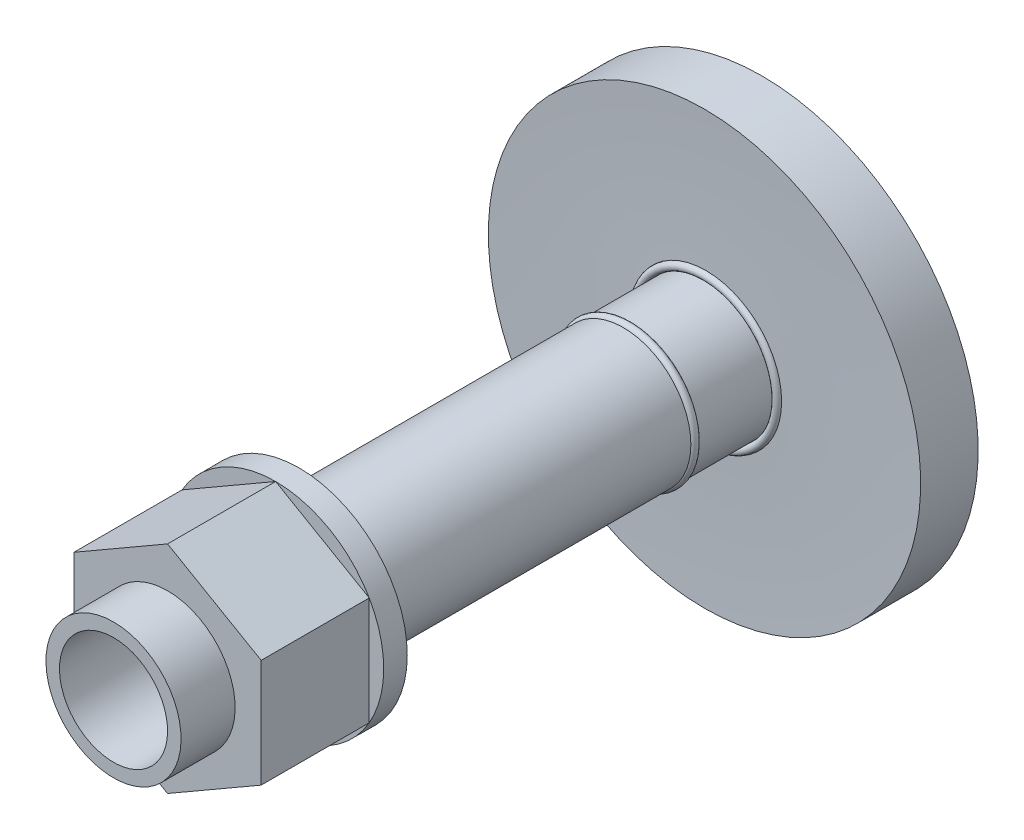
from build123d import *

# Parameters (mm, degrees)
SKETCH2_R          = 47.475732925
CUT_EXTRUDE1_DEPTH = 40
SKETCH3_W          = 3
SKETCH3_H          = 2
SKETCH3_W_2        = 2
SKETCH3_H_2        = 3
SKETCH4_W          = 2
SKETCH4_H          = 3
SKETCH5_R          = 1.5
SKETCH5_R_2        = 1.464909104
SKETCH5_R_3        = 1.4
SKETCH5_R_4        = 1.438808622


with BuildPart() as part:
    # Sketch1 → Revolve1 (revolve)
    with BuildSketch(Plane(origin=(0, 0, 0), x_dir=(0, 0, -1), z_dir=(1, 0, 0))):
        with BuildLine():
            Line((-146.741602405, 20), (93.258397595, 20))
            Line((93.258397595, 20), (93.258397595, 80))
            Line((93.258397595, 80), (71.96969697, 80))
            ThreePointArc((71.96969697, 80), (72.591794071, 52.503354195), (72.457468383, 25))
            Line((72.457468383, 25), (-76.741602405, 25))
            ThreePointArc((-76.741602405, 25), (-77.353874169, 32.502755976), (-78.03030303, 40))
            Line((-78.03030303, 40), (-126.741602405, 40))
            Line((-126.741602405, 40), (-126.741602405, 25))
            Line((-126.741602405, 25), (-146.741602405, 25))
            Line((-146.741602405, 25), (-146.741602405, 20))
        make_face()
    revolve(axis=Axis((0, 0, -93.258397595), (0, 0, 1)))

    # Sketch2 → Cut-Extrude1 (cut)
    with BuildSketch(Plane.XY.offset(126.741602405)):
        Circle(SKETCH2_R)
        Polygon((34.641016151, -20), (34.641016151, 20), (0, 40), (-34.641016151, 20), (-34.641016151, -20), (0, -40), align=None, mode=Mode.SUBTRACT)
    extrude(amount=-CUT_EXTRUDE1_DEPTH, mode=Mode.SUBTRACT)

    # Sketch3 → Cut-Revolve1 (revolve, cut)
    with BuildSketch(Plane(origin=(0, 0, 0), x_dir=(1, 0, 0), z_dir=(0, 1, 0))):
        with Locations((26.5, 72.96969697)):
            Rectangle(SKETCH3_W, SKETCH3_H)
        with Locations((24, 43.430612265)):
            Rectangle(SKETCH3_W_2, SKETCH3_H_2)
        with Locations((26.5, -77.741602405)):
            Rectangle(SKETCH3_W, SKETCH3_H)
    revolve(axis=Axis((0, 0, 0), (0, 0, -1)), mode=Mode.SUBTRACT)

    # Sketch4 → Cut-Revolve2 (revolve, cut)
    with BuildSketch(Plane(origin=(0, 0, 0), x_dir=(1, 0, 0), z_dir=(0, 1, 0))):
        with Locations((20.998754541, -92.205859438)):
            Rectangle(SKETCH4_W, SKETCH4_H)
        with Locations((20.998754541, 86.224989527)):
            Rectangle(SKETCH4_W, SKETCH4_H)
    revolve(axis=Axis((0, 0, -154.641449096), (0, 0, 1)), mode=Mode.SUBTRACT)

    # Sketch5 → Revolve2 (revolve)
    with BuildSketch(Plane(origin=(0, 0, 0), x_dir=(1, 0, 0), z_dir=(0, 1, 0))):
        with Locations((24.5, 43.430612265)):
            Circle(SKETCH5_R)
        with Locations((26.503158442, 72.508881384)):
            Circle(SKETCH5_R_2)
        with Locations((20.492344319, 86.242107482)):
            Circle(SKETCH5_R_3)
        with Locations((26.503158442, -77.264793694)):
            Circle(SKETCH5_R_4)
        with Locations((20.492344319, -92.249545542)):
            Circle(SKETCH5_R_3)
    revolve(axis=Axis((0, 0, -162.722824805), (0, 0, 1)))


with BuildPart() as revolve2_piece_1:
    # of the separate pieces the step leaves, piece 1, a body of its own (revolve2_pieces)
    add(part.part.solids().sort_by_distance((0, 20, 146.741602405))[0])


with BuildPart() as revolve2_piece_2:
    # of the separate pieces the step leaves, piece 2, a body of its own (revolve2_pieces)
    add(part.part.solids().sort_by_distance((26, 0, -43.430612265))[0])


with BuildPart() as revolve2_piece_3:
    # of the separate pieces the step leaves, piece 3, a body of its own (revolve2_pieces)
    add(part.part.solids().sort_by_distance((27.941967064, 0, 77.264793694))[0])


with BuildPart() as revolve2_piece_4:
    # of the separate pieces the step leaves, piece 4, a body of its own (revolve2_pieces)
    add(part.part.solids().sort_by_distance((21.892344319, 0, -86.242107482))[0])


with BuildPart() as revolve2_piece_5:
    # of the separate pieces the step leaves, piece 5, a body of its own (revolve2_pieces)
    add(part.part.solids().sort_by_distance((21.892344319, 0, 92.249545542))[0])


solid = Compound([revolve2_piece_1.part, revolve2_piece_2.part, revolve2_piece_3.part, revolve2_piece_4.part, revolve2_piece_5.part])
